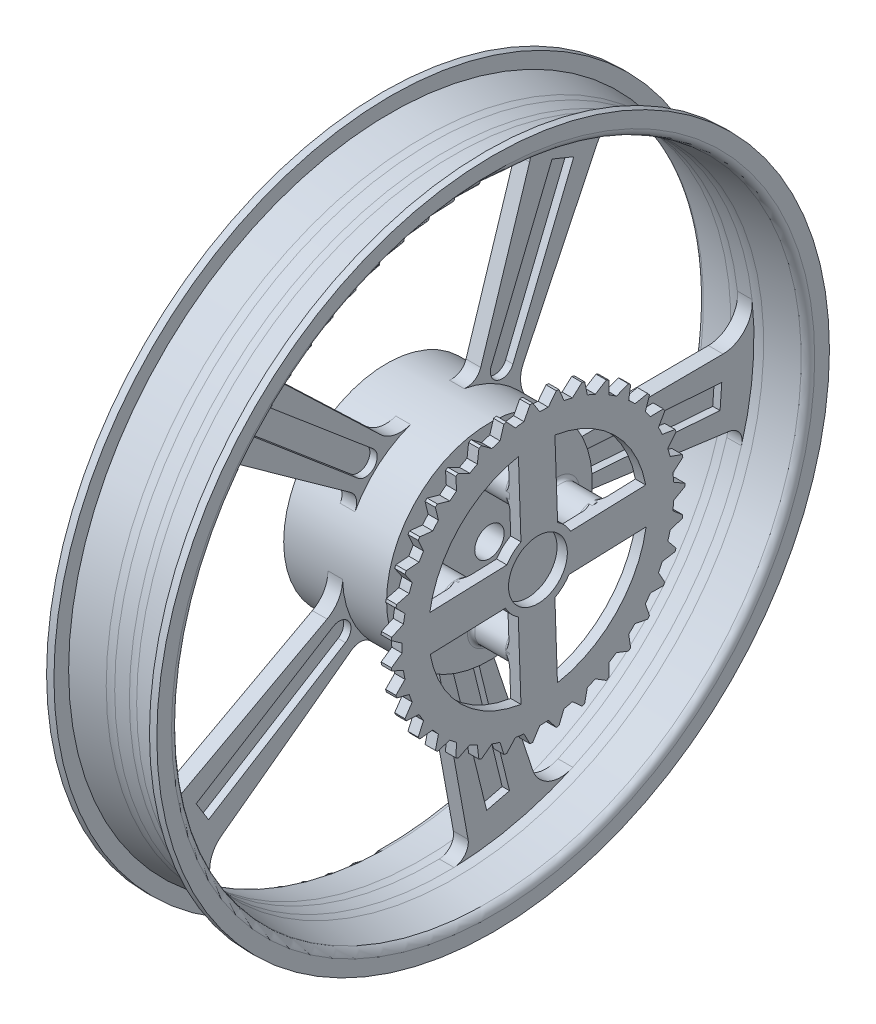
from build123d import *

# Parameters (mm, degrees)
SKETCH3_W                = 70
SKETCH3_H                = 70
BOSS_EXTRUDE1_DEPTH      = 5
FILLET3_R                = 9.999999999999996
FILLET4_R                = 20
CUT_EXTRUDE1_DEPTH       = 10
CIRPATTERN1_COUNT        = 5
FILLET3_OF_CIRPATTERN1_R = 9.999999999999996
FILLET4_OF_CIRPATTERN1_R = 20
SKETCH7_R                = 63.83120968259434
SKETCH7_R_2              = 15
CUT_EXTRUDE2_DEPTH       = 30
SKETCH8_R                = 10
CUT_EXTRUDE3_DEPTH       = 80
SKETCH9_R                = 12.500000000000002
BOSS_EXTRUDE2_DEPTH      = 26.000000000000004
CIRPATTERN2_COUNT        = 4
SKETCH10_R               = 92.49999999999993
SKETCH10_R_2             = 20
BOSS_EXTRUDE4_DEPTH      = 6.999999999999999
FILLET5_R                = 2.5
BOSS_EXTRUDE5_DEPTH      = 6.999999999999999
CIRPATTERN3_COUNT        = 35


with BuildPart() as part:
    # Sketch3 → Revolve2 (revolve)
    with BuildSketch(Plane.XY, mode=Mode.PRIVATE) as revolve2_sk:
        with Locations((0, 35)):
            Rectangle(SKETCH3_W, SKETCH3_H)
        with BuildLine():
            Line((-32.5, 228.83928571428575), (-32.5, 218.83928571428572))
            Line((-32.5, 218.83928571428572), (-10.352941176470623, 215.4117647058823))
            ThreePointArc((-10.352941176470623, 215.4117647058823), (-7.684377460965821, 215.10309300744458), (-5.0000000000000115, 214.99999999999997))
            Line((-5.0000000000000115, 214.99999999999997), (0, 215))
            Line((0, 215), (4.999999999999999, 214.99999999999997))
            ThreePointArc((4.999999999999999, 214.99999999999997), (7.684377460965802, 215.10309300744458), (10.35294117647061, 215.4117647058823))
            Line((10.35294117647061, 215.4117647058823), (32.500000000000014, 218.83928571428572))
            Line((32.500000000000014, 218.83928571428572), (32.5, 228.83928571428575))
            Line((32.5, 228.83928571428575), (37.5, 228.83928571428575))
            Line((37.5, 228.83928571428575), (37.50000000000001, 218.83928571428572))
            ThreePointArc((37.50000000000001, 218.83928571428572), (36.29628301182648, 215.5853288470059), (33.26470588235296, 213.89810924369752))
            Line((33.26470588235296, 213.89810924369752), (11.117647058823565, 210.47058823529412))
            ThreePointArc((11.117647058823565, 210.47058823529412), (8.067859955389501, 210.11782057993673), (5, 210.00000000000003))
            Line((5, 210.00000000000003), (0, 210))
            Line((0, 210), (-5, 210.00000000000003))
            ThreePointArc((-5, 210.00000000000003), (-8.067859955389494, 210.11782057993673), (-11.117647058823565, 210.47058823529412))
            Line((-11.117647058823565, 210.47058823529412), (-33.26470588235296, 213.89810924369752))
            ThreePointArc((-33.26470588235296, 213.89810924369752), (-36.29628301182648, 215.5853288470059), (-37.50000000000001, 218.83928571428572))
            Line((-37.50000000000001, 218.83928571428572), (-37.5, 228.83928571428575))
            Line((-37.5, 228.83928571428575), (-32.5, 228.83928571428575))
        make_face()
    revolve(revolve2_sk.sketch.rotate(Axis((-74.37962712467782, 0, 0), (1, 0, 0)), 90), axis=Axis((-74.37962712467782, 0, 0), (1, 0, 0)))

    # Sketch4 → Boss-Extrude1 (add, symmetric)
    with BuildSketch(Plane(origin=(0, 0, 0), x_dir=(0, 0, -1), z_dir=(1, 0, 0))):
        with BuildLine():
            Line((21.23795264678118, 66.7004450312971), (63.71385794034352, 200.10133509389118))
            ThreePointArc((63.71385794034352, 200.10133509389118), (86.90157160955759, 191.17561782766379), (108.87278447748128, 179.5737085436505))
            Line((108.87278447748128, 179.5737085436505), (47.28564284516834, 51.61461014789497))
            ThreePointArc((47.28564284516834, 51.61461014789497), (35.08228026110046, 60.57419922443551), (21.23795264678118, 66.7004450312971))
        make_face()
    boss_extrude1 = extrude(amount=BOSS_EXTRUDE1_DEPTH, both=True)

    # Fillet3
    fillet3_edges = [part.edges().sort_by_distance(p)[0] for p in [
        (0, 66.7004450312971, -21.237952646781185),
        (0, 179.57370854365047, -108.87278447748128),
    ]]
    fillet(fillet3_edges, radius=FILLET3_R)

    # Fillet4
    # the kernel refuses this fillet: 20 mm, written as the material it adds along each edge
    with BuildSketch(Plane(origin=(5, 51.61461014789498, -47.28564284516834), x_dir=(0, -0.7357525971057591, -0.6772504085285814), z_dir=(-1, 0, 0))) as fillet4_piece_1:
        with BuildLine():
            CenterArc((13.60311435540117, -19.92758581081523), FILLET4_R, 94.8771441677141, 63.45367533523475)
            Line((-4.983512135679122, -12.542647376334395), (0, 0))
            ThreePointArc((0, 0), (5.951362530488057, -0.2534496621466966), (11.902725060976051, -6e-17))
        make_face()
    extrude(amount=10)
    with BuildSketch(Plane(origin=(-5, 200.10133509389118, -63.71385794034352), x_dir=(0, 0.2527571289689047, 0.9675297585890557), z_dir=(1, 0, 0))) as fillet4_piece_2:
        with BuildLine():
            CenterArc((21.081932629755247, 19.972202690026094), FILLET4_R, 176.97883579047297, 96.04232841905412)
            Line((1.10972993972914, 21.026299321513847), (0, 0))
            ThreePointArc((0, 0), (11.068014630621358, -0.29187175472586535), (22.136029261243024, -5.6e-16))
        make_face()
    extrude(amount=10)

    # Sketch5 → Cut-Extrude1 (cut)
    with BuildSketch(Plane(origin=(0, 0, 0), x_dir=(0, 0, -1), z_dir=(1, 0, 0))):
        with BuildLine():
            Line((46.017406160058485, 66.68131969506658), (87.40833214773546, 168.12902440295898))
            Line((87.40833214773546, 168.12902440295898), (72.59393716451734, 174.17333588411256))
            Line((72.59393716451734, 174.17333588411256), (31.203011176840523, 72.7256311762201))
            ThreePointArc((31.203011176840523, 72.7256311762201), (35.58805292787273, 62.296277944034365), (46.017406160058485, 66.68131969506658))
        make_face()
    cut_extrude1 = extrude(amount=CUT_EXTRUDE1_DEPTH, mode=Mode.SUBTRACT)

    # CirPattern1: Boss-Extrude1, Cut-Extrude1 ×5 about axis
    cirpattern1_axis = Axis((0, 8e-16, 2.05e-15), (1, 0, 0))
    add([boss_extrude1.rotate(cirpattern1_axis, i * 360 / CIRPATTERN1_COUNT) for i in range(1, CIRPATTERN1_COUNT)])
    add([cut_extrude1.rotate(cirpattern1_axis, i * 360 / CIRPATTERN1_COUNT) for i in range(1, CIRPATTERN1_COUNT)], mode=Mode.SUBTRACT)

    # Fillet3 of CirPattern1
    fillet3_of_cirpattern1_edges = [part.edges().sort_by_distance(p)[0] for p in [
        (0, 40.81006430453198, 56.87300459321602),
        (0, 159.0354988074281, 137.14120503726278),
        (0, -41.478438208027484, 56.38740252771758),
        (0, -81.28436486286651, 193.63071044862798),
        (0, -66.44514891735525, -22.023673293764812),
        (0, -209.27199904662731, -17.470844714221254),
        (0, 0.41307778955365965, -69.99878118038758),
        (0, -48.05284344158477, -204.42828629418818),
    ]]
    fillet(fillet3_of_cirpattern1_edges, radius=FILLET3_OF_CIRPATTERN1_R)

    # Fillet4 of CirPattern1
    # the kernel refuses this fillet: 20 mm, written as the material it adds along each edge
    with BuildSketch(Plane(origin=(5, 60.92111044883982, 34.47634408808832), x_dir=(0, 0.4167433580334789, -0.9090241875412224), z_dir=(-1, 0, 0))) as fillet4_of_cirpattern1_piece_1:
        with BuildLine():
            CenterArc((13.603114355401155, -19.92758581081522), FILLET4_OF_CIRPATTERN1_R, 94.87714416771409, 63.45367533523482)
            Line((-4.983512135679136, -12.5426473763344), (0, 0))
            ThreePointArc((0, 0), (5.951362530488047, -0.25344966214669373), (11.902725060976044, -5.2e-16))
        make_face()
    extrude(amount=10)
    with BuildSketch(Plane(origin=(-5, 122.43019291359586, 170.61901377964796), x_dir=(0, -0.5830009186361705, -0.8124714941888), z_dir=(1, 0, 0))) as fillet4_of_cirpattern1_piece_2:
        with BuildLine():
            CenterArc((21.055563723088085, -19.999999999999996), FILLET4_OF_CIRPATTERN1_R, 89.99999999999999, 96.04232841905417)
            ThreePointArc((1.1666756939394587, -22.105263157894743), (0.29187175472578275, -11.068014630621388), (0, 0))
            Line((0, 0), (21.055563723088092, -7.6e-16))
        make_face()
    extrude(amount=10)
    with BuildSketch(Plane(origin=(5, -13.963293258125601, 68.59319529944342), x_dir=(0, 0.9933141569562157, 0.11544256403234682), z_dir=(-1, 0, 0))) as fillet4_of_cirpattern1_piece_3:
        with BuildLine():
            CenterArc((13.603114355401235, -19.92758581081522), FILLET4_OF_CIRPATTERN1_R, 94.87714416771412, 63.45367533523479)
            Line((-4.983512135679063, -12.542647376334395), (0, 0))
            ThreePointArc((0, 0), (5.951362530488053, -0.25344966214669884), (11.902725060976108, 2e-16))
        make_face()
    extrude(amount=10)
    with BuildSketch(Plane(origin=(-5, -124.43531462408242, 169.16220758315265), x_dir=(0, 0.5925491172575359, -0.8055343218245358), z_dir=(1, 0, 0))) as fillet4_of_cirpattern1_piece_4:
        with BuildLine():
            CenterArc((21.055563723088135, -19.99999999999999), FILLET4_OF_CIRPATTERN1_R, 89.99999999999993, 96.04232841905423)
            ThreePointArc((1.1666756939395087, -22.105263157894747), (0.29187175472583377, -11.068014630621503), (0, 0))
            Line((0, 0), (21.055563723088156, 7.8e-16))
        make_face()
    extrude(amount=10)
    with BuildSketch(Plane(origin=(5, -69.5509002772437, 7.916582003927243), x_dir=(0, 0.19715855247191014, 0.9803716158616492), z_dir=(-1, 0, 0))) as fillet4_of_cirpattern1_piece_5:
        with BuildLine():
            CenterArc((13.60311435540118, -19.92758581081523), FILLET4_OF_CIRPATTERN1_R, 94.87714416771412, 63.45367533523482)
            Line((-4.983512135679125, -12.542647376334422), (0, 0))
            ThreePointArc((0, 0), (5.951362530488031, -0.2534496621467056), (11.90272506097606, -2.2e-16))
        make_face()
    extrude(amount=10)
    with BuildSketch(Plane(origin=(-5, -199.33544675206565, -66.07101988129442), x_dir=(0, 0.9492164131050748, 0.3146239041966395), z_dir=(1, 0, 0))) as fillet4_of_cirpattern1_piece_6:
        with BuildLine():
            CenterArc((21.055563723088145, -19.999999999999993), FILLET4_OF_CIRPATTERN1_R, 90.00000000000003, 96.04232841905412)
            ThreePointArc((1.1666756939395322, -22.105263157894736), (0.29187175472584925, -11.0680146306215), (0, 0))
            Line((0, 0), (21.055563723088138, 1.8e-16))
        make_face()
    extrude(amount=10)
    with BuildSketch(Plane(origin=(5, -29.021527061365504, -63.70047854629063), x_dir=(0, -0.8714634703558451, 0.4904604161758081), z_dir=(-1, 0, 0))) as fillet4_of_cirpattern1_piece_7:
        with BuildLine():
            CenterArc((13.603114355401154, -19.927585810815227), FILLET4_OF_CIRPATTERN1_R, 94.87714416771405, 63.45367533523475)
            Line((-4.983512135679129, -12.54264737633438), (0, 0))
            ThreePointArc((0, 0), (5.9513625304880335, -0.2534496621466981), (11.902725060976053, -1.2e-16))
        make_face()
    extrude(amount=10)
    with BuildSketch(Plane(origin=(-5, 1.2392333686609818, -209.99634354116264), x_dir=(0, -0.005901111279338003, 0.9999825882912506), z_dir=(1, 0, 0))) as fillet4_of_cirpattern1_piece_8:
        with BuildLine():
            CenterArc((21.055563723088135, -19.999999999999993), FILLET4_OF_CIRPATTERN1_R, 90.00000000000004, 96.04232841905394)
            ThreePointArc((1.1666756939395304, -22.10526315789469), (0.29187175472582993, -11.06801463062141), (0, 0))
            Line((0, 0), (21.055563723088124, 0))
        make_face()
    extrude(amount=10)

    # Sketch7 → Cut-Extrude2 (cut)
    with BuildSketch(Plane.ZY.offset(45.00000000000001)):
        Circle(SKETCH7_R)
        Circle(SKETCH7_R_2, mode=Mode.SUBTRACT)
    extrude(amount=-CUT_EXTRUDE2_DEPTH, mode=Mode.SUBTRACT)

    # Sketch8 → Cut-Extrude3 (cut, symmetric)
    with BuildSketch(Plane(origin=(0, 0, 0), x_dir=(0, 0, -1), z_dir=(1, 0, 0))):
        Circle(SKETCH8_R)
    extrude(amount=CUT_EXTRUDE3_DEPTH, both=True, mode=Mode.SUBTRACT)

    # Sketch9 → Boss-Extrude2 (add)
    with BuildSketch(Plane(origin=(35, 0, 0), x_dir=(0, 0, -1), z_dir=(1, 0, 0))):
        with Locations(Location((0, 46.30696385641949, 0), (0, 0, 180))):
            Circle(SKETCH9_R)
    boss_extrude2 = extrude(amount=BOSS_EXTRUDE2_DEPTH)

    # CirPattern2: Boss-Extrude2 ×4 about axis
    cirpattern2_axis = Axis((0, 0, -8.084e-14), (1, 0, 0))
    for i in range(1, CIRPATTERN2_COUNT):
        add(boss_extrude2.rotate(cirpattern2_axis, i * 360 / CIRPATTERN2_COUNT))

    # Sketch10 → Boss-Extrude4 (add)
    with BuildSketch(Plane(origin=(61.00000000000001, 0, 0), x_dir=(0, 0, -1), z_dir=(1, 0, 0))):
        with Locations(Location((7.105e-14, -6.75e-14, 0), (0, 0, 180))):
            Circle(SKETCH10_R)
        with BuildLine():
            Line((13.376271400525326, 21.120496287244023), (11.550467360607291, 73.59916238485015))
            ThreePointArc((11.550467360607282, 73.59916238485016), (52.060256617229484, 53.29145973744956), (73.30912682610739, 13.267325427293082))
            Line((73.30912682610739, 13.267325427293082), (22.17175463853828, 11.550467360607367))
            ThreePointArc((22.17175463853828, 11.550467360607367), (18.406843896568787, 16.917094838279663), (13.376271400525322, 21.12049628724402))
        make_face(mode=Mode.SUBTRACT)
        with BuildLine():
            Line((21.12049628724362, -13.376271400525955), (73.5991623848501, -11.550467360607545))
            ThreePointArc((73.5991623848501, -11.55046736060755), (53.29145973744937, -52.06025661722968), (13.26732542729283, -73.30912682610746))
            Line((13.267325427292828, -73.30912682610744), (11.550467360607291, -22.171754638538317))
            ThreePointArc((11.550467360607291, -22.17175463853832), (16.91709483827935, -18.406843896569075), (21.120496287243608, -13.376271400525965))
        make_face(mode=Mode.SUBTRACT)
        with Locations(Location((0, 8.9e-16, 0), (0, 0, 180))):
            Circle(SKETCH10_R_2, mode=Mode.SUBTRACT)
        with BuildLine():
            Line((-13.376271400526033, -21.120496287243576), (-11.550467360607808, -73.59916238485006))
            ThreePointArc((-11.550467360607817, -73.59916238485006), (-52.06025661722987, -53.2914597374492), (-73.30912682610747, -13.267325427292567))
            Line((-73.30912682610749, -13.26732542729257), (-22.17175463853836, -11.550467360607213))
            ThreePointArc((-22.171754638538363, -11.550467360607215), (-18.406843896569125, -16.917094838279294), (-13.376271400526022, -21.120496287243572))
        make_face(mode=Mode.SUBTRACT)
        with BuildLine():
            Line((-21.120496287243522, 13.376271400526104), (-73.59916238485002, 11.55046736060806))
            ThreePointArc((-73.59916238485005, 11.55046736060805), (-53.291459737449316, 52.0602566172298), (-13.267325427293091, 73.30912682610743))
            Line((-13.26732542729309, 73.30912682610742), (-11.550467360607445, 22.171754638538246))
            ThreePointArc((-11.550467360607442, 22.171754638538243), (-16.917094838279354, 18.40684389656907), (-21.120496287243522, 13.376271400526104))
        make_face(mode=Mode.SUBTRACT)
    extrude(amount=BOSS_EXTRUDE4_DEPTH)

    # Fillet5
    # the kernel refuses this fillet: 2.5 mm, written as the material it adds along each edge
    with BuildSketch(Plane(origin=(35, 46.30696385641949, 0), x_dir=(0, 0, 1), z_dir=(0, 1, 0))) as fillet5_piece_1:
        with BuildLine():
            CenterArc((12.500000000000002 + FILLET5_R, FILLET5_R), FILLET5_R, 180, 90)
            Line((12.500000000000002, FILLET5_R), (12.500000000000002, 0))
            Line((12.500000000000002, 0), (12.500000000000002 + FILLET5_R, 0))
        make_face()
    revolve(axis=Axis((35, 46.30696385641949, 0), (1, 0, 0)))
    with BuildSketch(Plane(origin=(35, 7.056e-14, -46.30696385641957), x_dir=(0, 1, 0), z_dir=(0, 0, -1))) as fillet5_piece_2:
        with BuildLine():
            CenterArc((12.500000000000002 + FILLET5_R, FILLET5_R), FILLET5_R, 180, 90)
            Line((12.500000000000002, FILLET5_R), (12.500000000000002, 0))
            Line((12.500000000000002, 0), (12.500000000000002 + FILLET5_R, 0))
        make_face()
    revolve(axis=Axis((35, 7.056e-14, -46.30696385641957), (1, 0, 0)))
    with BuildSketch(Plane(origin=(35, -46.30696385641949, -1.5601e-13), x_dir=(0, 0, -1), z_dir=(0, -1, 0))) as fillet5_piece_3:
        with BuildLine():
            CenterArc((12.500000000000002 + FILLET5_R, FILLET5_R), FILLET5_R, 180, 90)
            Line((12.500000000000002, FILLET5_R), (12.500000000000002, 0))
            Line((12.500000000000002, 0), (12.500000000000002 + FILLET5_R, 0))
        make_face()
    revolve(axis=Axis((35, -46.30696385641949, -1.5601e-13), (1, 0, 0)))
    with BuildSketch(Plane(origin=(35, -7.57e-14, 46.306963856419415), x_dir=(0, -1, 0), z_dir=(0, 0, 1))) as fillet5_piece_4:
        with BuildLine():
            CenterArc((12.500000000000002 + FILLET5_R, FILLET5_R), FILLET5_R, 180, 90)
            Line((12.500000000000002, FILLET5_R), (12.500000000000002, 0))
            Line((12.500000000000002, 0), (12.500000000000002 + FILLET5_R, 0))
        make_face()
    revolve(axis=Axis((35, -7.57e-14, 46.306963856419415), (1, 0, 0)))
    with BuildSketch(Plane(origin=(61, -7.57e-14, 46.306963856419415), x_dir=(0, 0.9084834648027282, -0.4179207989320826), z_dir=(0, -0.4179207989320826, -0.9084834648027282))) as fillet5_piece_5_section:
        with BuildLine():
            CenterArc((12.500000000000005 + FILLET5_R, -FILLET5_R), FILLET5_R, 89.99999999999983, 90.00000000000017)
            Line((12.500000000000005 + FILLET5_R, 0), (12.500000000000005, 0))
            Line((12.500000000000005, 0), (12.499999999999998, -FILLET5_R))
        make_face()
    fillet5_piece_5 = revolve(axis=Axis((61, -7.57e-14, 46.306963856419415), (1, 0, 0)), revolution_arc=226.5434999140048, mode=Mode.PRIVATE)
    fillet5_piece_5 = split(fillet5_piece_5, bisect_by=Plane(origin=(61, 12.484887810309758, 46.74133005314382), z_dir=(0, -0.9993953295992243, -0.034770320321474625)), keep=Keep.TOP, mode=Mode.PRIVATE)
    fillet5_piece_5 = split(fillet5_piece_5, bisect_by=Plane(origin=(61, -12.346852544554494, 45.89243740575354), z_dir=(0, 0.9994368876897808, 0.03355454551867295)), keep=Keep.TOP, mode=Mode.PRIVATE)
    add(fillet5_piece_5)
    with BuildSketch(Plane(origin=(61, -7.57e-14, 46.306963856419415), x_dir=(0, -0.9510867727198524, 0.30892385915842735), z_dir=(0, 0.30892385915842735, 0.9510867727198524))) as fillet5_piece_6_section:
        with BuildLine():
            CenterArc((12.500000000000005 + FILLET5_R, -FILLET5_R), FILLET5_R, 89.99999999999996, 90.00000000000006)
            Line((12.500000000000005 + FILLET5_R, 0), (12.500000000000005, 0))
            Line((12.500000000000005, 0), (12.499999999999996, -FILLET5_R))
        make_face()
    fillet5_piece_6 = revolve(axis=Axis((61, -7.57e-14, 46.306963856419415), (1, 0, 0)), revolution_arc=226.68303311950544, mode=Mode.PRIVATE)
    fillet5_piece_6 = split(fillet5_piece_6, bisect_by=Plane(origin=(61, 12.484887810309756, 46.74133005314382), z_dir=(0, -0.9993953295992243, -0.034770320321474625)), keep=Keep.TOP, mode=Mode.PRIVATE)
    fillet5_piece_6 = split(fillet5_piece_6, bisect_by=Plane(origin=(61, -12.346852544554494, 45.89243740575354), z_dir=(0, 0.9994368876897808, 0.03355454551867295)), keep=Keep.TOP, mode=Mode.PRIVATE)
    add(fillet5_piece_6)
    with BuildSketch(Plane(origin=(61, 46.30696385641949, 0), x_dir=(0, -0.4179207989303227, -0.9084834648035377), z_dir=(0, -0.9084834648035377, 0.4179207989303227))) as fillet5_piece_7_section:
        with BuildLine():
            CenterArc((12.500000000000004 + FILLET5_R, -FILLET5_R), FILLET5_R, 90, 90)
            Line((12.500000000000004 + FILLET5_R, 0), (12.500000000000004, 0))
            Line((12.500000000000004, 0), (12.500000000000004, -FILLET5_R))
        make_face()
    fillet5_piece_7 = revolve(axis=Axis((61, 46.30696385641949, 0), (1, 0, 0)), revolution_arc=226.5434999139075, mode=Mode.PRIVATE)
    fillet5_piece_7 = split(fillet5_piece_7, bisect_by=Plane(origin=(61, 46.74133005314387, -12.484887810308994), z_dir=(0, -0.0347703203214747, 0.9993953295992243)), keep=Keep.TOP, mode=Mode.PRIVATE)
    fillet5_piece_7 = split(fillet5_piece_7, bisect_by=Plane(origin=(61, 45.89243740575353, 12.346852544554862), z_dir=(0, 0.0335545455186785, -0.9994368876897806)), keep=Keep.TOP, mode=Mode.PRIVATE)
    add(fillet5_piece_7)
    with BuildSketch(Plane(origin=(61, -46.30696385641949, -1.5601e-13), x_dir=(0, 0.41792079893191086, 0.9084834648028072), z_dir=(0, 0.9084834648028072, -0.41792079893191086))) as fillet5_piece_8_section:
        with BuildLine():
            CenterArc((12.500000000000002 + FILLET5_R, -FILLET5_R), FILLET5_R, 90, 90)
            Line((12.500000000000002 + FILLET5_R, 0), (12.500000000000002, 0))
            Line((12.500000000000002, 0), (12.500000000000002, -FILLET5_R))
        make_face()
    fillet5_piece_8 = revolve(axis=Axis((61, -46.30696385641949, -1.5601e-13), (1, 0, 0)), revolution_arc=226.54349991399684, mode=Mode.PRIVATE)
    fillet5_piece_8 = split(fillet5_piece_8, bisect_by=Plane(origin=(61, -46.74133005314394, 12.484887810309596), z_dir=(0, 0.03477032032147808, -0.9993953295992242)), keep=Keep.TOP, mode=Mode.PRIVATE)
    fillet5_piece_8 = split(fillet5_piece_8, bisect_by=Plane(origin=(61, -45.89243740575357, -12.346852544554658), z_dir=(0, -0.033554545518676454, 0.9994368876897807)), keep=Keep.TOP, mode=Mode.PRIVATE)
    add(fillet5_piece_8)
    with BuildSketch(Plane(origin=(61, 7.056e-14, -46.30696385641957), x_dir=(0, -0.908483464803054, 0.41792079893137446), z_dir=(0, 0.41792079893137446, 0.908483464803054))) as fillet5_piece_9_section:
        with BuildLine():
            CenterArc((12.500000000000004 + FILLET5_R, -FILLET5_R), FILLET5_R, 90, 90)
            Line((12.500000000000004 + FILLET5_R, 0), (12.500000000000004, 0))
            Line((12.500000000000004, 0), (12.500000000000004, -FILLET5_R))
        make_face()
    fillet5_piece_9 = revolve(axis=Axis((61, 7.056e-14, -46.30696385641957), (1, 0, 0)), revolution_arc=226.54349991397052, mode=Mode.PRIVATE)
    fillet5_piece_9 = split(fillet5_piece_9, bisect_by=Plane(origin=(61, 12.34685254455482, -45.8924374057536), z_dir=(0, -0.9994368876897806, -0.03355454551867993)), keep=Keep.TOP, mode=Mode.PRIVATE)
    fillet5_piece_9 = split(fillet5_piece_9, bisect_by=Plane(origin=(61, -12.484887810309425, -46.74133005314405), z_dir=(0, 0.9993953295992241, 0.03477032032148159)), keep=Keep.TOP, mode=Mode.PRIVATE)
    add(fillet5_piece_9)
    with BuildSketch(Plane(origin=(61, 46.30696385641949, 0), x_dir=(0, 0.3089238591586456, 0.9510867727197815), z_dir=(0, 0.9510867727197815, -0.3089238591586456))) as fillet5_piece_10_section:
        with BuildLine():
            CenterArc((12.499999999999996 + FILLET5_R, -FILLET5_R), FILLET5_R, 90, 90)
            Line((12.499999999999996 + FILLET5_R, 0), (12.499999999999996, 0))
            Line((12.499999999999996, 0), (12.499999999999996, -FILLET5_R))
        make_face()
    fillet5_piece_10 = revolve(axis=Axis((61, 46.30696385641949, 0), (1, 0, 0)), revolution_arc=226.68303311944436, mode=Mode.PRIVATE)
    fillet5_piece_10 = split(fillet5_piece_10, bisect_by=Plane(origin=(61, 46.74133005314387, -12.484887810308994), z_dir=(0, -0.0347703203214747, 0.9993953295992243)), keep=Keep.TOP, mode=Mode.PRIVATE)
    fillet5_piece_10 = split(fillet5_piece_10, bisect_by=Plane(origin=(61, 45.89243740575353, 12.346852544554862), z_dir=(0, 0.0335545455186785, -0.9994368876897806)), keep=Keep.TOP, mode=Mode.PRIVATE)
    add(fillet5_piece_10)
    with BuildSketch(Plane(origin=(61, 7.056e-14, -46.30696385641957), x_dir=(0, 0.9510867727198006, -0.3089238591585864), z_dir=(0, -0.3089238591585864, -0.9510867727198006))) as fillet5_piece_11_section:
        with BuildLine():
            CenterArc((12.499999999999995 + FILLET5_R, -FILLET5_R), FILLET5_R, 90, 90)
            Line((12.499999999999995 + FILLET5_R, 0), (12.499999999999995, 0))
            Line((12.499999999999995, 0), (12.499999999999995, -FILLET5_R))
        make_face()
    fillet5_piece_11 = revolve(axis=Axis((61, 7.056e-14, -46.30696385641957), (1, 0, 0)), revolution_arc=226.68303311944084, mode=Mode.PRIVATE)
    fillet5_piece_11 = split(fillet5_piece_11, bisect_by=Plane(origin=(61, 12.346852544554821, -45.8924374057536), z_dir=(0, -0.9994368876897806, -0.03355454551867993)), keep=Keep.TOP, mode=Mode.PRIVATE)
    fillet5_piece_11 = split(fillet5_piece_11, bisect_by=Plane(origin=(61, -12.484887810309425, -46.74133005314405), z_dir=(0, 0.9993953295992241, 0.03477032032148159)), keep=Keep.TOP, mode=Mode.PRIVATE)
    add(fillet5_piece_11)
    with BuildSketch(Plane(origin=(61, -46.30696385641949, -1.5601e-13), x_dir=(0, -0.3089238591584665, -0.9510867727198397), z_dir=(0, -0.9510867727198397, 0.3089238591584665))) as fillet5_piece_12_section:
        with BuildLine():
            CenterArc((12.500000000000004 + FILLET5_R, -FILLET5_R), FILLET5_R, 90, 90)
            Line((12.500000000000004 + FILLET5_R, 0), (12.500000000000004, 0))
            Line((12.500000000000004, 0), (12.500000000000004, -FILLET5_R))
        make_face()
    fillet5_piece_12 = revolve(axis=Axis((61, -46.30696385641949, -1.5601e-13), (1, 0, 0)), revolution_arc=226.68303311949737, mode=Mode.PRIVATE)
    fillet5_piece_12 = split(fillet5_piece_12, bisect_by=Plane(origin=(61, -46.74133005314394, 12.484887810309596), z_dir=(0, 0.03477032032147808, -0.9993953295992242)), keep=Keep.TOP, mode=Mode.PRIVATE)
    fillet5_piece_12 = split(fillet5_piece_12, bisect_by=Plane(origin=(61, -45.89243740575357, -12.346852544554658), z_dir=(0, -0.033554545518676454, 0.9994368876897807)), keep=Keep.TOP, mode=Mode.PRIVATE)
    add(fillet5_piece_12)

    # Sketch11 → Boss-Extrude5 (add)
    with BuildSketch(Plane(origin=(68, 0, 0), x_dir=(0, 0, -1), z_dir=(1, 0, 0))):
        Polygon((99.99290571569475, 0.9518840294751277), (99.99290571569475, -0.9518840294751194), (87.92919139117053, -7.91687274216602), (87.92919139117042, 7.916872742165956), align=None)
    boss_extrude5 = extrude(amount=-BOSS_EXTRUDE5_DEPTH)

    # CirPattern3: Boss-Extrude5 ×35 about axis
    cirpattern3_axis = Axis((0, -1.9e-15, 3.49e-15), (1, 0, 0))
    for i in range(1, CIRPATTERN3_COUNT):
        add(boss_extrude5.rotate(cirpattern3_axis, i * 360 / CIRPATTERN3_COUNT))


solid = part.part
